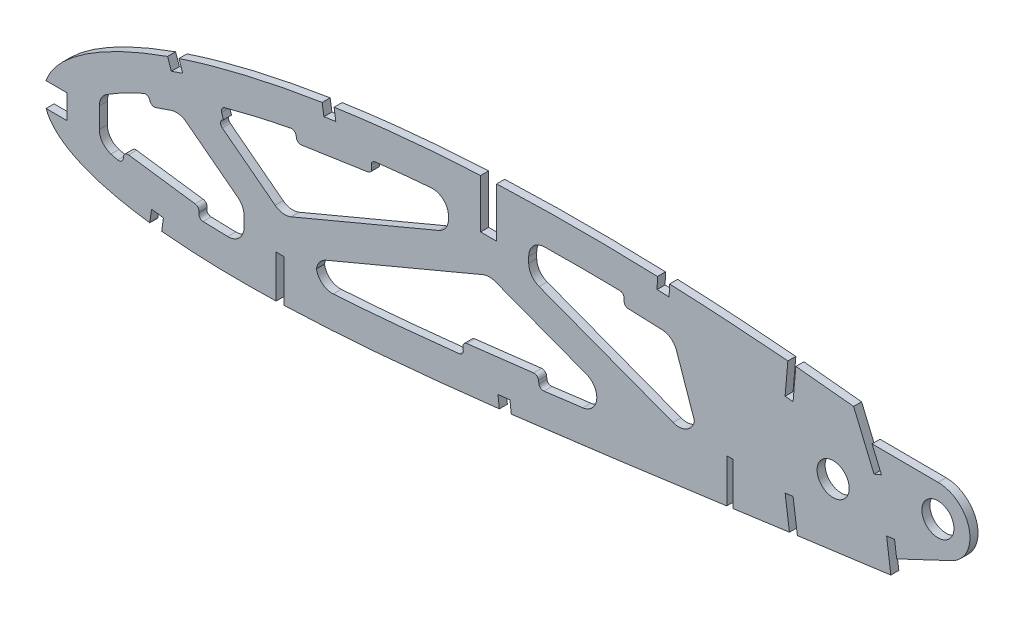
from build123d import *

# Parameters (mm, degrees)
BOSS_EXTRUDE1_DEPTH = 3.175
CUT_EXTRUDE1_DEPTH  = 7.62
SKETCH3_R           = 6.35
CUT_EXTRUDE2_DEPTH  = 7.62
CUT_EXTRUDE3_DEPTH  = 495.005666426
SKETCH5_R           = 6.35
CUT_EXTRUDE5_DEPTH  = 495.005666426
CUT_EXTRUDE9_DEPTH  = 7.62
CUT_EXTRUDE10_DEPTH = 7.62
FILLET1_DEPTH       = 3.175
FILLET2_START       = -1
FILLET2_DEPTH       = 5
FILLET2_2_DEPTH     = 3.175


with BuildPart() as part:
    # Sketch1 → Boss-Extrude1 (new body)
    with BuildSketch(Plane.XY):
        with BuildLine():
            Line((485.587399664, -0.75798934), (490.147728055, -1.684578565))
            Line((490.147728055, -1.684578565), (486.193791136, 0.75798934))
            add(Edge.make_bspline(
                [(486.193791136, 0.75798934), (486.156545565, 0.780998011), (486.007707871, 0.872943377), (485.672349582, 1.078647636), (485.113908292, 1.42125844), (484.332139179, 1.898395939), (483.327649378, 2.508793191), (482.099933618, 3.248176053), (480.649758178, 4.11414228), (478.977474042, 5.102596174), (477.083252712, 6.208909725), (474.9678154, 7.428600903), (472.631346146, 8.754764469), (470.074750091, 10.181981707), (467.298904376, 11.703464898), (464.304334104, 13.312342155), (461.092111509, 15.00042968), (457.663469746, 16.760467008), (454.019033833, 18.582734695), (450.160522056, 20.459648763), (446.08922006, 22.381851369), (441.806517314, 24.339086509), (437.314874314, 26.32337623), (432.615532729, 28.322383702), (427.711170694, 30.327448406), (422.603876177, 32.32715893), (417.296673201, 34.312408193), (411.791609239, 36.270335128), (406.092799427, 38.19238362), (400.203008281, 40.066067188), (394.126447785, 41.881210299), (387.866648542, 43.626044211), (381.42882875, 45.291620487), (374.81707141, 46.865809768), (368.036980395, 48.338075006), (361.093945075, 49.699552264), (353.993788332, 50.936649002), (346.7561854, 52.048400815), (339.497587697, 52.97319004), (332.253923966, 53.880196397), (325.021047815, 54.732245847), (317.699770737, 55.548201081), (310.297136308, 56.323468086), (302.820487344, 57.055622539), (295.277392798, 57.741504683), (287.675691417, 58.379102964), (280.022738792, 58.964804598), (272.326604726, 59.497707184), (264.594897726, 59.973125915), (256.835853078, 60.39070372), (249.05734719, 60.747528421), (241.267474913, 61.041141246), (233.474507978, 61.269769861), (225.686535745, 61.431223873), (217.911990598, 61.524488163), (210.158959277, 61.547014441), (202.435870244, 61.498399603), (194.750810842, 61.376974546), (187.112218127, 61.181076903), (179.528190462, 60.910341158), (172.006928802, 60.56488465), (164.556668167, 60.141814477), (157.185490761, 59.643826715), (149.90160498, 59.068829465), (142.713013757, 58.416669795), (135.627250794, 57.690066178), (128.652204991, 56.887042275), (121.795351463, 56.009883049), (115.064190238, 55.060308222), (108.466273869, 54.03780049), (102.008670179, 52.945313451), (95.69834878, 51.783964779), (89.541985966, 50.557159213), (83.546284377, 49.265216856), (77.717590812, 47.912013041), (72.061962755, 46.499905586), (66.585479912, 45.031479446), (61.293693841, 43.510258272), (56.191955701, 41.93969324), (51.286212878, 40.321510147), (46.580173058, 38.661844322), (42.079617138, 36.961873954), (37.787992638, 35.226836263), (33.71032906, 33.459100147), (29.849672544, 31.664054679), (26.210392495, 29.843743399), (22.795082621, 28.003266258), (19.607171667, 26.145445317), (16.649728276, 24.273731457), (13.923995526, 22.392872215), (11.433731376, 20.504048278), (9.179791317, 18.61203256), (7.163601692, 16.719706143), (5.388044474, 14.828372521), (3.853055719, 12.941362387), (2.560647106, 11.060170164), (1.511042845, 9.186575935), (0.706617001, 7.321940679), (0.14657185, 5.467313049), (-0.159993132, 3.625430402), (-0.236298987, 1.794816138), (-0.078648638, 0.597378122), (0, 0)],
                knots=[0, 0, 0, 0, 0.00025409, 0.001015373, 0.002283359, 0.004056577, 0.006330982, 0.009105274, 0.012374489, 0.016134023, 0.020379661, 0.025105976, 0.030306237, 0.035972206, 0.042099522, 0.048678064, 0.055701664, 0.063160184, 0.071045824, 0.079349827, 0.08806291, 0.097175757, 0.106678111, 0.116561573, 0.126814276, 0.137428301, 0.148393618, 0.15969976, 0.171338125, 0.183297699, 0.195569604, 0.208143556, 0.221011593, 0.234161831, 0.24758745, 0.261276822, 0.27522271, 0.289414144, 0.3037712, 0.317689226, 0.331784111, 0.346039677, 0.36044387, 0.374982721, 0.389640454, 0.404403317, 0.4192566, 0.434186749, 0.449177265, 0.464214782, 0.479284009, 0.49436974, 0.509457833, 0.524532346, 0.53957932, 0.554582984, 0.569529546, 0.584403417, 0.599190992, 0.613876838, 0.628447475, 0.642888675, 0.657186054, 0.671325546, 0.685294014, 0.699078147, 0.712665095, 0.726042645, 0.739197713, 0.752117586, 0.764792042, 0.777208152, 0.789355685, 0.80122396, 0.812803686, 0.824082909, 0.835054602, 0.845709571, 0.856037853, 0.866033834, 0.875688843, 0.884997719, 0.893953426, 0.902552897, 0.910789386, 0.918660734, 0.926166253, 0.933302626, 0.94007122, 0.94647478, 0.952517526, 0.958204819, 0.963546652, 0.9685566, 0.973249913, 0.977651041, 0.981787043, 0.985694226, 0.989415109, 0.993001157, 0.996508416, 1, 1, 1, 1], degree=3))
            add(Edge.make_bspline(
                [(0, 0), (0.124852845, -0.589388692), (0.375132337, -1.770874799), (1.055109044, -3.471725282), (1.954345773, -5.106735278), (3.091715472, -6.671561797), (4.459655687, -8.165777182), (6.055145152, -9.59093561), (7.876619233, -10.946270738), (9.92169391, -12.231165798), (12.187398396, -13.446984767), (14.671186068, -14.592971696), (17.370792198, -15.668768481), (20.283275494, -16.672937055), (23.405075375, -17.607006726), (26.733223776, -18.468701274), (30.263936284, -19.259225009), (33.993816996, -19.976560109), (37.918801514, -20.621435301), (42.034812323, -21.193489669), (46.337624631, -21.693081077), (50.82301706, -22.119161118), (55.4865531, -22.47264634), (60.323584549, -22.753771214), (65.329416188, -22.963427152), (70.499252954, -23.100817142), (75.828031579, -23.168083162), (81.310936338, -23.16623498), (86.942603653, -23.09477832), (92.718222737, -22.957660649), (98.632251256, -22.754013473), (104.679350026, -22.486301136), (110.854064483, -22.157217858), (117.150856575, -21.767879174), (123.564184912, -21.320010643), (130.088480981, -20.817203984), (136.717818035, -20.260713235), (143.446414433, -19.653782206), (150.268313286, -18.999449162), (157.177620607, -18.29978506), (164.168237687, -17.558081099), (171.233938121, -16.77674083), (178.368711149, -15.959932594), (185.566039209, -15.10913432), (192.819836156, -14.229203613), (200.123278023, -13.321821748), (207.470257634, -12.390483576), (214.854167095, -11.43957439), (222.268093801, -10.46898568), (229.705802131, -9.485632582), (237.16011938, -8.488705064), (244.624557097, -7.483330472), (252.092205531, -6.472633763), (259.555791095, -5.456925983), (267.00875308, -4.440416464), (274.444177456, -3.425895825), (281.854781181, -2.413456633), (289.233859631, -1.408131206), (296.573982386, -0.40979664), (303.868380953, 0.579523), (311.110065241, 1.55687475), (318.292203182, 2.521024953), (325.407385919, 3.471363717), (332.448454941, 4.408247897), (339.302915498, 5.303240759), (345.952856872, 6.204000824), (352.420688138, 6.942424504), (358.80798662, 7.572695641), (365.121387221, 8.089431053), (371.353308903, 8.500064921), (377.496611311, 8.807531395), (383.543972889, 9.016123146), (389.487754946, 9.132028332), (395.320533551, 9.158188245), (401.034347101, 9.102945563), (406.621764277, 8.970753247), (412.074986888, 8.767544827), (417.386407281, 8.500176147), (422.548480993, 8.175935919), (427.553458197, 7.799606866), (432.394364707, 7.379974648), (437.06373176, 6.923182232), (441.554389355, 6.434448486), (445.859785012, 5.92401425), (449.973027478, 5.395240442), (453.887929886, 4.85681652), (457.598190253, 4.314198878), (461.097932514, 3.774315295), (464.381658048, 3.242315892), (467.444062607, 2.72526199), (470.280349076, 2.227984348), (472.885595604, 1.755339323), (475.25618804, 1.313290259), (477.38744454, 0.904033197), (479.2765147, 0.534312721), (480.919885909, 0.205760173), (482.315149055, -0.076995438), (483.459867496, -0.312838295), (484.352302675, -0.497896754), (484.990691913, -0.632466588), (485.3743447, -0.712542465), (485.54480657, -0.748903783), (485.587399664, -0.75798934)],
                knots=[0, 0, 0, 0, 0.003638255, 0.007293231, 0.011028136, 0.014901081, 0.018963272, 0.023258475, 0.027820626, 0.032679082, 0.03785316, 0.043361875, 0.049214679, 0.055422346, 0.061988786, 0.068918036, 0.076211157, 0.083868392, 0.091887411, 0.100265912, 0.108999867, 0.118084529, 0.127514843, 0.13728527, 0.147387917, 0.157816481, 0.168563473, 0.179619128, 0.190977373, 0.202626974, 0.214560478, 0.226767249, 0.239236417, 0.251959004, 0.264923894, 0.278119703, 0.291536035, 0.30516028, 0.318980685, 0.332985499, 0.34716279, 0.361498603, 0.375980747, 0.390597192, 0.405332593, 0.420174823, 0.435109533, 0.450124276, 0.465203068, 0.480333154, 0.495500583, 0.510689775, 0.525887334, 0.541078314, 0.556247233, 0.571381785, 0.58646604, 0.601484516, 0.616424329, 0.631269423, 0.646006524, 0.660620684, 0.675098188, 0.689422858, 0.703581824, 0.716907564, 0.730009274, 0.742952128, 0.755725558, 0.768319952, 0.780724337, 0.792926528, 0.804916041, 0.816679084, 0.828203524, 0.8394749, 0.850481359, 0.861207697, 0.871639326, 0.881763414, 0.891563605, 0.901027364, 0.910138977, 0.918883976, 0.927249278, 0.935221104, 0.942784738, 0.949928188, 0.956638464, 0.962904204, 0.968712288, 0.974054485, 0.978918432, 0.983297218, 0.987180246, 0.990560674, 0.993433357, 0.995790626, 0.997629587, 0.998945816, 0.999736592, 1, 1, 1, 1], degree=3))
        make_face()
    extrude(amount=BOSS_EXTRUDE1_DEPTH)

    # Sketch2 → Cut-Extrude1 (cut)
    with BuildSketch(Plane(origin=(0, 0, 0), x_dir=(-1, 0, 0), z_dir=(0, 0, -1))):
        Polygon((-272.758362457, 13.219227593), (-272.758362457, -3.727335201), (-272.758362457, -6.174624217), (-270.218362457, -4.538950955), (-270.218362457, -3.727335201), (-270.218362457, 13.219227593), align=None)
        Polygon((-179.095862457, 60.936207213), (-179.095862457, 41.210430096), (-172.745862457, 41.210430096), (-172.745862457, 60.936207213), (-172.745862457, 62.491605953), (-179.095862457, 65.673418397), align=None)
        Polygon((-94.958362457, -6.174624217), (-94.958362457, -22.484645348), (-94.958362457, -23.41160534), (-91.783362457, -23.055975463), (-91.783362457, -22.484645348), (-91.783362457, -6.174624217), align=None)
    extrude(amount=-CUT_EXTRUDE1_DEPTH, mode=Mode.SUBTRACT)

    # Sketch3 → Cut-Extrude2 (cut)
    with BuildSketch(Plane(origin=(0, 0, 0), x_dir=(-1, 0, 0), z_dir=(0, 0, -1))):
        with Locations((-312.347728055, 26.255421435)):
            Circle(SKETCH3_R)
    extrude(amount=-CUT_EXTRUDE2_DEPTH, mode=Mode.SUBTRACT)

    # Sketch4 → Cut-Extrude3 (cut, through all)
    with BuildSketch(Plane.XY.offset(3.175)):
        with BuildLine():
            Line((9.062901794, 7.052169294), (0.650194113, 7.052169294))
            add(Edge.make_bspline(
                [(0.650194113, 7.052169294), (0.465708548, 6.521896536), (0.133397668, 5.38816083), (-0.159993132, 3.625430402), (-0.236298987, 1.794816138), (-0.078648638, 0.597378122), (0, 0)],
                knots=[0.98615895, 0.98615895, 0.98615895, 0.98615895, 0.989415109, 0.993001157, 0.996508416, 1, 1, 1, 1], degree=3))
            add(Edge.make_bspline(
                [(0, 0), (0.124852845, -0.589388692), (0.302256405, -1.426851801), (0.579848755, -2.235845493), (0.669602921, -2.472830706)],
                knots=[0, 0, 0, 0, 0.003638255, 0.005169601, 0.005169601, 0.005169601, 0.005169601], degree=3))
            Line((0.669602921, -2.472830706), (9.062901794, -2.472830706))
            Line((9.062901794, -2.472830706), (9.062901794, 7.052169294))
        make_face()
        with BuildLine():
            add(Edge.make_bspline(
                [(0.650194113, 7.052169294), (0.465708548, 6.521896536), (0.133397668, 5.38816083), (-0.159993132, 3.625430402), (-0.236298987, 1.794816138), (-0.078648638, 0.597378122), (0, 0)],
                knots=[0.98615895, 0.98615895, 0.98615895, 0.98615895, 0.989415109, 0.993001157, 0.996508416, 1, 1, 1, 1], degree=3))
            Line((0.650194113, 7.052169294), (-0.462098206, 7.052169294))
            Line((-0.462098206, 7.052169294), (-0.462098206, -2.472830706))
            Line((-0.462098206, -2.472830706), (0.669602921, -2.472830706))
            add(Edge.make_bspline(
                [(0, 0), (0.124852845, -0.589388692), (0.302256405, -1.426851801), (0.579848755, -2.235845493), (0.669602921, -2.472830706)],
                knots=[0, 0, 0, 0, 0.003638255, 0.005169601, 0.005169601, 0.005169601, 0.005169601], degree=3))
        make_face()
        with BuildLine():
            Line((54.794831429, 36.648863619), (53.302696873, 40.981678359))
            add(Edge.make_bspline(
                [(53.302696873, 40.981678359), (52.61286541, 40.752815486), (51.108174168, 40.246442968), (49.608389515, 39.725673213), (48.796794552, 39.438833377)],
                knots=[0.861815619, 0.861815619, 0.861815619, 0.861815619, 0.866033834, 0.871029674, 0.871029674, 0.871029674, 0.871029674], degree=3))
            Line((48.796794552, 39.438833377), (50.292020972, 35.098046912))
            Line((50.292020972, 35.098046912), (54.794831429, 36.648863619))
        make_face()
        with BuildLine():
            Line((41.787252136, -20.850695067), (41.7474831, -21.140589239))
            add(Edge.make_bspline(
                [(41.7474831, -21.140589239), (41.824488615, -21.150525072), (43.333830589, -21.344316226), (44.907255765, -21.527003651), (46.405229922, -21.684741935), (46.467066592, -21.691225989)],
                knots=[0.099796316, 0.099796316, 0.099796316, 0.099796316, 0.100265912, 0.108999867, 0.109375913, 0.109375913, 0.109375913, 0.109375913], degree=3))
            Line((46.467066592, -21.691225989), (46.491055727, -21.515107109))
            Line((46.491055727, -21.515107109), (47.147668691, -16.75670807))
            Line((47.147668691, -16.75670807), (42.43642749, -16.110398001))
            Line((42.43642749, -16.110398001), (41.787252136, -20.850695067))
        make_face()
        with BuildLine():
            add(Edge.make_bspline(
                [(41.7474831, -21.140589239), (41.824488615, -21.150525072), (43.333830589, -21.344316226), (44.907255765, -21.527003651), (46.405229922, -21.684741935), (46.467066592, -21.691225989)],
                knots=[0.099796316, 0.099796316, 0.099796316, 0.099796316, 0.100265912, 0.108999867, 0.109375913, 0.109375913, 0.109375913, 0.109375913], degree=3))
            Line((41.7474831, -21.140589239), (41.245228792, -24.801744004))
            Line((41.245228792, -24.801744004), (45.955369961, -25.447903166))
            Line((45.955369961, -25.447903166), (46.467066592, -21.691225989))
        make_face()
        with BuildLine():
            Line((115.411216261, 50.423603453), (114.727657639, 54.994935898))
            add(Edge.make_bspline(
                [(114.727657639, 54.994935898), (113.150509681, 54.76041064), (111.574494653, 54.518257541), (109.999719487, 54.268289878)],
                knots=[0.739781871, 0.739781871, 0.739781871, 0.739781871, 0.749036025, 0.749036025, 0.749036025, 0.749036025], degree=3))
            Line((109.999719487, 54.268289878), (110.701108213, 49.719265409))
            Line((110.701108213, 49.719265409), (115.411216261, 50.423603453))
        make_face()
        with BuildLine():
            add(Edge.make_bspline(
                [(180.171004029, -15.744952069), (181.749324096, -15.559869925), (183.327429501, -15.372956575), (184.90534275, -15.184435959)],
                knots=[0.379684808, 0.379684808, 0.379684808, 0.379684808, 0.389296233, 0.389296233, 0.389296233, 0.389296233], degree=3))
            Line((184.90534275, -15.184435959), (184.356728474, -10.534942837))
            Line((184.356728474, -10.534942837), (179.627040288, -11.093017525))
            Line((179.627040288, -11.093017525), (180.171004029, -15.744952069))
        make_face()
        with BuildLine():
            Line((247.390399473, 56.230958409), (247.578395082, 60.797552648))
            add(Edge.make_bspline(
                [(247.578395082, 60.797552648), (245.984239368, 60.86167677), (244.389922115, 60.921786857), (242.795461786, 60.97783048)],
                knots=[0.482152267, 0.482152267, 0.482152267, 0.482152267, 0.491412006, 0.491412006, 0.491412006, 0.491412006], degree=3))
            Line((242.795461786, 60.97783048), (242.631589462, 56.412390301))
            Line((242.631589462, 56.412390301), (247.390399473, 56.230958409))
        make_face()
        Polygon((294.40507718, 57.808484267), (297.56784199, 57.529978748), (296.472728055, 44.881943939), (293.309562632, 45.155822576), align=None)
        with BuildLine():
            add(Edge.make_bspline(
                [(295.036807926, -0.619102057), (296.085502034, -0.476588541), (297.134206476, -0.334150977), (298.182924105, -0.191810533)],
                knots=[0, 0, 0, 0, 1, 1, 1, 1], degree=3))
            Line((298.182924105, -0.191810533), (296.472728055, 12.392767846))
            Line((296.472728055, 12.392767846), (293.326645717, 11.965227294))
            Line((293.326645717, 11.965227294), (295.036807926, -0.619102057))
        make_face()
        with BuildLine():
            Line((298.509707059, -2.59646215), (298.182924105, -0.191810533))
            add(Edge.make_bspline(
                [(295.036807926, -0.619102057), (296.085502034, -0.476588541), (297.134206476, -0.334150977), (298.182924105, -0.191810533)],
                knots=[0, 0, 0, 0, 1, 1, 1, 1], degree=3))
            Line((295.036807926, -0.619102057), (295.328583802, -3.088940197))
            Line((295.328583802, -3.088940197), (298.509707059, -2.59646215))
        make_face()
    extrude(amount=-CUT_EXTRUDE3_DEPTH, mode=Mode.SUBTRACT)


with BuildPart() as cut_extrude3_kept_piece:
    # of the separate pieces the step leaves, the one the design keeps (cut_extrude3_pieces_kept)
    add(part.part.solids().sort_by_distance((485.587399664, -0.75798934, 0))[0])

    # Sketch5 → Cut-Extrude5 (cut, through all)
    with BuildSketch(Plane.XY.offset(3.175)):
        with Locations((353.832919875, 33.232574886)):
            Circle(SKETCH5_R)
    extrude(amount=-CUT_EXTRUDE5_DEPTH, mode=Mode.SUBTRACT)

    # Sketch6 → Cut-Extrude9 (cut)
    with BuildSketch(Plane(origin=(0, 0, 0), x_dir=(-1, 0, 0), z_dir=(0, 0, -1))):
        with BuildLine():
            Line((-327.753809852, 46.057810612), (-331.453456008, 37.280667379))
            Line((-331.453456008, 37.280667379), (-328.527741597, 36.047451994))
            Line((-328.527741597, 36.047451994), (-321.128449286, 53.601738459))
            Line((-321.128449286, 53.601738459), (-317.790242381, 61.521393181))
            Line((-317.790242381, 61.521393181), (-514.651526297, 76.475822003))
            Line((-514.651526297, 76.475822003), (-498.413214754, -38.047006775))
            Line((-498.413214754, -38.047006775), (-335.182817631, 4.763039252))
            Line((-335.182817631, 4.763039252), (-333.516134292, 17.353200754))
            Line((-333.516134292, 17.353200754), (-336.663674667, 17.769871589))
            Line((-336.663674667, 17.769871589), (-337.497016337, 11.474790838))
            Line((-337.497016337, 11.474790838), (-359.255381148, 21.748372095))
            ThreePointArc((-359.255381148, 21.748372095), (-366.23187163, 35.981391973), (-353.8938353, 45.932428795))
            Line((-353.8938353, 45.932428795), (-327.753809852, 46.057810612))
        make_face()
    extrude(amount=-CUT_EXTRUDE9_DEPTH, mode=Mode.SUBTRACT)

    # Sketch7 → Cut-Extrude10 (cut)
    with BuildSketch(Plane(origin=(0, 0, 0), x_dir=(-1, 0, 0), z_dir=(0, 0, -1))):
        with BuildLine():
            Line((-191.79586246, 35.636390316), (-191.79586246, 48.593590966))
            add(Edge.make_bspline(
                [(-191.79586246, 48.593590966), (-194.947742991, 48.672167599), (-201.251688751, 48.789985812), (-210.714122089, 48.853923109), (-220.178220019, 48.809690173), (-226.489591064, 48.710234484), (-229.644558964, 48.643649352)],
                knots=[0.121974497, 0.121974497, 0.121974497, 0.121974497, 0.309757138, 0.497539778, 0.685322418, 0.873105059, 0.873105059, 0.873105059, 0.873105059], degree=3))
            Line((-229.644558964, 48.643649352), (-229.48521526, 44.20437536))
            Line((-229.48521526, 44.20437536), (-248.891837233, 43.464488679))
            Line((-248.891837233, 43.464488679), (-257.518362457, 18.502913174))
            Line((-257.518362457, 18.502913174), (-257.518362457, 10.736351923))
            Line((-257.518362457, 10.736351923), (-191.79586246, 35.636390316))
        make_face()
        with BuildLine():
            Line((-107.658362457, -9.607113499), (-107.658362457, -0.709195855))
            Line((-107.658362457, -0.709195855), (-176.042623936, 28.023836531))
            Line((-176.042623936, 28.023836531), (-238.217406918, 4.467908448))
            add(Edge.make_bspline(
                [(-196.023618722, -1.032687245), (-199.540285566, -0.594653843), (-206.570896125, 0.294533789), (-217.119095381, 1.66162252), (-227.668063289, 3.053878273), (-234.701374525, 3.994956751), (-238.217406918, 4.467908448)],
                knots=[0.338101016, 0.338101016, 0.338101016, 0.338101016, 0.481994526, 0.625888035, 0.769781544, 0.913675053, 0.913675053, 0.913675053, 0.913675053], degree=3))
            Line((-196.023618722, -1.032687245), (-195.481027558, 3.56576015))
            Line((-195.481027558, 3.56576015), (-165.539531563, 0.032844157))
            Line((-165.539531563, 0.032844157), (-166.077556286, -4.568300384))
            add(Edge.make_bspline(
                [(-107.658362457, -9.607113499), (-112.527480958, -9.343730572), (-122.253868861, -8.715147959), (-136.863916935, -7.5251334), (-151.469960854, -6.138042935), (-161.211151019, -5.105470024), (-166.077556286, -4.568300384)],
                knots=[0.088650257, 0.088650257, 0.088650257, 0.088650257, 0.293249758, 0.497849259, 0.70244876, 0.907048261, 0.907048261, 0.907048261, 0.907048261], degree=3))
        make_face()
        with BuildLine():
            Line((-160.045862457, 35.077981459), (-94.307868179, 7.45683183))
            Line((-94.307868179, 7.45683183), (-67.862121325, 27.717253053))
            Line((-67.862121325, 27.717253053), (-70.937887187, 28.77658014))
            Line((-70.937887187, 28.77658014), (-69.597188192, 32.669660912))
            add(Edge.make_bspline(
                [(-69.597188192, 32.669660912), (-72.048300438, 33.353969811), (-76.964507952, 34.65883166), (-84.404673933, 36.449093236), (-91.887886191, 38.082795077), (-96.906758154, 39.075219685), (-99.419258475, 39.548192007)],
                knots=[0.151488346, 0.151488346, 0.151488346, 0.151488346, 0.326718884, 0.501949421, 0.677179959, 0.852410496, 0.852410496, 0.852410496, 0.852410496], degree=3))
            Line((-99.419258475, 39.548192007), (-100.075929965, 35.289191879))
            Line((-100.075929965, 35.289191879), (-129.849728439, 39.741492922))
            Line((-129.849728439, 39.741492922), (-129.191480565, 44.143558413))
            add(Edge.make_bspline(
                [(-129.191480565, 44.143558413), (-131.75327506, 44.459716525), (-136.880521808, 45.054977888), (-144.588732985, 45.842272199), (-152.309866282, 46.528260609), (-157.466847891, 46.921282613), (-160.045862457, 47.102373106)],
                knots=[0.145865613, 0.145865613, 0.145865613, 0.145865613, 0.321281856, 0.496698098, 0.67211434, 0.847530583, 0.847530583, 0.847530583, 0.847530583], degree=3))
            Line((-160.045862457, 47.102373106), (-160.045862457, 35.077981459))
        make_face()
        with BuildLine():
            Line((-79.083362457, 3.121902297), (-79.083362457, -10.463821932))
            add(Edge.make_bspline(
                [(-79.083362457, -10.463821932), (-77.563003161, -10.466266649), (-74.520718627, -10.454806626), (-69.966862179, -10.38447701), (-65.421068879, -10.25697491), (-62.402825335, -10.129408024), (-60.892970489, -10.053632048)],
                knots=[0.1994192, 0.1994192, 0.1994192, 0.1994192, 0.345131723, 0.490844245, 0.636556768, 0.78226929, 0.78226929, 0.78226929, 0.78226929], degree=3))
            Line((-60.892970489, -10.053632048), (-61.465856007, -5.901996226))
            Line((-61.465856007, -5.901996226), (-31.5774301, -1.801762384))
            Line((-31.5774301, -1.801762384), (-30.948701379, -6.392757546))
            add(Edge.make_bspline(
                [(-30.948701379, -6.392757546), (-30.157078307, -6.212830315), (-28.572887294, -5.832169738), (-26.244901191, -5.203855136), (-23.964951823, -4.508855169), (-22.495451176, -3.999764625), (-21.762901794, -3.727289386)],
                knots=[0.316984494, 0.316984494, 0.316984494, 0.316984494, 0.436482572, 0.555980651, 0.675478729, 0.794976808, 0.794976808, 0.794976808, 0.794976808], degree=3))
            Line((-21.762901794, -3.727289386), (-21.762901794, 12.3569693))
            add(Edge.make_bspline(
                [(-21.762901794, 12.3569693), (-22.485713516, 12.871304647), (-23.946210775, 13.863781661), (-26.995933142, 15.782547153), (-30.973640972, 18.027704874), (-35.957277852, 20.528528125), (-39.374554059, 22.071181385), (-41.091891456, 22.811562983)],
                knots=[0.179419269, 0.179419269, 0.179419269, 0.179419269, 0.258794815, 0.338170361, 0.496921453, 0.655672544, 0.814423636, 0.814423636, 0.814423636, 0.814423636], degree=3))
            Line((-41.091891456, 22.811562983), (-42.420377223, 18.954840736))
            Line((-42.420377223, 18.954840736), (-53.455747952, 22.755541978))
            Line((-53.455747952, 22.755541978), (-79.083362457, 3.121902297))
        make_face()
    extrude(amount=-CUT_EXTRUDE10_DEPTH, mode=Mode.SUBTRACT)

    # Fillet1: read off the stored shape, not the designer's step
    # Fillet1 outline → Fillet1 (add)
    with BuildSketch(Plane.XY):
        with BuildLine():
            add(Edge.make_bspline(
                [(26.370126448, -5.226300247), (26.331032698, -5.215142403), (25.523563297, -4.983968756), (23.964951823, -4.508855169), (22.495451176, -3.999764625), (21.762901794, -3.727289386)],
                knots=[0.54990416, 0.54990416, 0.54990416, 0.54990416, 0.555980651, 0.675478729, 0.794976808, 0.794976808, 0.794976808, 0.794976808], degree=3))
            ThreePointArc((26.370126448, -5.226300247), (23.043921451, -2.94478541), (21.762901794, 0.879863368))
            Line((21.762901794, 0.879863368), (21.762901794, -3.727289386))
        make_face()
        with BuildLine():
            Line((21.762901794, 12.3569693), (21.762901794, 8.976965526))
            ThreePointArc((21.762901794, 8.976965526), (22.544922642, 12.029850745), (24.698368932, 14.330792692))
            add(Edge.make_bspline(
                [(21.762901794, 12.3569693), (22.485713516, 12.871304647), (23.454406807, 13.529577587), (24.451414905, 14.173291784), (24.698368932, 14.330792692)],
                knots=[0.179419269, 0.179419269, 0.179419269, 0.179419269, 0.258794815, 0.28471294, 0.28471294, 0.28471294, 0.28471294], degree=3))
        make_face()
        with BuildLine():
            Line((79.083362457, -10.463821932), (79.083362457, -4.073978435))
            ThreePointArc((79.083362457, -4.073978435), (77.190824363, -8.596536711), (72.641304706, -10.423311106))
            add(Edge.make_bspline(
                [(79.083362457, -10.463821932), (77.563003161, -10.466266649), (75.413933546, -10.45817129), (73.268047675, -10.432398132), (72.641304706, -10.423311106)],
                knots=[0.1994192, 0.1994192, 0.1994192, 0.1994192, 0.345131723, 0.405281835, 0.405281835, 0.405281835, 0.405281835], degree=3))
        make_face()
        with BuildLine():
            Line((79.083362457, 3.121902297), (76.595143679, 5.028158181))
            ThreePointArc((76.595143679, 5.028158181), (78.427430017, 2.798120343), (79.083362457, -0.012590354))
            Line((79.083362457, -0.012590354), (79.083362457, 3.121902297))
        make_face()
        with BuildLine():
            ThreePointArc((50.232412236, 21.645390234), (53.31830221, 21.909355752), (56.161997924, 20.682249638))
            Line((56.161997924, 20.682249638), (53.455747952, 22.755541978))
            Line((53.455747952, 22.755541978), (50.232412236, 21.645390234))
        make_face()
        with BuildLine():
            ThreePointArc((153.182534733, 46.583384691), (158.000677723, 44.922257289), (160.045862457, 40.254167153))
            Line((160.045862457, 40.254167153), (160.045862457, 47.102373106))
            add(Edge.make_bspline(
                [(153.182534733, 46.583384691), (155.469028821, 46.768829542), (157.757239412, 46.941673015), (160.045862457, 47.102373106)],
                knots=[0.691865834, 0.691865834, 0.691865834, 0.691865834, 0.847530583, 0.847530583, 0.847530583, 0.847530583], degree=3))
        make_face()
        with BuildLine():
            ThreePointArc((160.045862457, 39.297654474), (158.984627042, 35.783188773), (156.155635949, 33.443424006))
            Line((156.155635949, 33.443424006), (160.045862457, 35.077981459))
            Line((160.045862457, 35.077981459), (160.045862457, 39.297654474))
        make_face()
        with BuildLine():
            ThreePointArc((97.704647392, 8.884057408), (94.434414381, 8.440220286), (91.383092679, 9.697539341))
            Line((91.383092679, 9.697539341), (94.307868179, 7.45683183))
            Line((94.307868179, 7.45683183), (97.704647392, 8.884057408))
        make_face()
        with BuildLine():
            Line((238.217406918, 4.467908448), (214.658298466, 13.393659979))
            ThreePointArc((214.658298466, 13.393659979), (218.715500901, 6.717402319), (213.22631845, 1.158429037))
            add(Edge.make_bspline(
                [(238.217406918, 4.467908448), (234.701374525, 3.994956751), (227.668063289, 3.053878273), (219.337714047, 1.954436436), (214.523927555, 1.326941616), (213.22631845, 1.158429037)],
                knots=[0.338101016, 0.338101016, 0.338101016, 0.338101016, 0.481994526, 0.625888035, 0.678992143, 0.678992143, 0.678992143, 0.678992143], degree=3))
        make_face()
        with BuildLine():
            ThreePointArc((107.742134816, -3.900816755), (109.022505127, -0.996474347), (111.548588965, 0.925361597))
            Line((111.548588965, 0.925361597), (107.658362457, -0.709195855))
            Line((107.658362457, -0.709195855), (107.658362457, -9.607113499))
            add(Edge.make_bspline(
                [(114.410021767, -9.210048742), (112.1601201, -9.352648306), (109.909874671, -9.485323512), (107.658362457, -9.607113499)],
                knots=[0.812440114, 0.812440114, 0.812440114, 0.812440114, 0.907048261, 0.907048261, 0.907048261, 0.907048261], degree=3))
            ThreePointArc((114.410021767, -9.210048742), (110.052951417, -7.840382126), (107.742134816, -3.900816755))
        make_face()
        with BuildLine():
            ThreePointArc((173.704611923, 27.041473434), (176.051308225, 27.536236079), (178.414134341, 27.125351231))
            Line((178.414134341, 27.125351231), (176.042623936, 28.023836531))
            Line((176.042623936, 28.023836531), (173.704611923, 27.041473434))
        make_face()
        with BuildLine():
            ThreePointArc((244.550970789, 43.629986274), (248.091456487, 42.385174627), (250.31075261, 39.358737823))
            Line((250.31075261, 39.358737823), (248.891837233, 43.464488679))
            Line((248.891837233, 43.464488679), (244.550970789, 43.629986274))
        make_face()
        with BuildLine():
            ThreePointArc((257.394515021, 18.684606869), (254.242806526, 14.376510801), (248.918613531, 13.994506717))
            Line((248.918613531, 13.994506717), (257.518362457, 10.736351923))
            Line((257.518362457, 10.736351923), (257.518362457, 18.502913174))
            Line((257.518362457, 18.502913174), (257.170065285, 19.510740303))
            ThreePointArc((257.170065285, 19.510740303), (257.29622799, 19.101460315), (257.394515021, 18.684606869))
        make_face()
        with BuildLine():
            Line((191.79586246, 48.593590966), (191.79586246, 42.374654055))
            ThreePointArc((191.79586246, 42.374654055), (193.618162404, 46.826893065), (198.039148193, 48.723757304))
            add(Edge.make_bspline(
                [(191.79586246, 48.593590966), (193.876822148, 48.645469457), (195.95782209, 48.688774854), (198.039148193, 48.723757304)],
                knots=[0.121974497, 0.121974497, 0.121974497, 0.121974497, 0.245953849, 0.245953849, 0.245953849, 0.245953849], degree=3))
        make_face()
        with BuildLine():
            ThreePointArc((195.896113534, 34.082943488), (192.920520094, 36.41296401), (191.79586246, 40.021051753))
            Line((191.79586246, 40.021051753), (191.79586246, 35.636390316))
            Line((191.79586246, 35.636390316), (195.896113534, 34.082943488))
        make_face()
    extrude(amount=FILLET1_DEPTH)

    # Fillet2: read off the stored shape, not the designer's step
    # Fillet2 outline → Fillet2 (cut)
    with BuildSketch(Plane.XY.offset(FILLET2_START)):
        with BuildLine():
            ThreePointArc((44.101392599, 19.533800644), (42.74313732, 19.616758748), (41.841343736, 20.635830768))
            Line((41.841343736, 20.635830768), (42.420377223, 18.954840736))
            Line((42.420377223, 18.954840736), (44.101392599, 19.533800644))
        make_face()
        with BuildLine():
            Line((61.465856007, -5.901996226), (59.702960833, -5.660154034))
            ThreePointArc((59.702960833, -5.660154034), (60.878177539, -6.347519133), (61.222620016, -7.664699631))
            Line((61.222620016, -7.664699631), (61.465856007, -5.901996226))
        make_face()
        with BuildLine():
            Line((31.5774301, -1.801762384), (31.336131852, -3.563729114))
            ThreePointArc((31.336131852, -3.563729114), (32.022828579, -2.388653081), (33.339340784, -2.04346952))
            Line((33.339340784, -2.04346952), (31.5774301, -1.801762384))
        make_face()
        with BuildLine():
            ThreePointArc((129.586786216, 41.499932152), (129.257680682, 40.179510323), (128.091290742, 39.478540448))
            Line((128.091290742, 39.478540448), (129.849728439, 39.741492922))
            Line((129.849728439, 39.741492922), (129.586786216, 41.499932152))
        make_face()
        with BuildLine():
            ThreePointArc((101.826408928, 35.550954224), (100.509229866, 35.877657247), (99.806219473, 37.038463834))
            Line((99.806219473, 37.038463834), (100.075929965, 35.289191879))
            Line((100.075929965, 35.289191879), (101.826408928, 35.550954224))
        make_face()
        with BuildLine():
            Line((195.481027558, 3.56576015), (193.715277764, 3.357412321))
            ThreePointArc((193.715277764, 3.357412321), (195.024875359, 2.987560424), (195.689376182, 1.800010449))
            Line((195.689376182, 1.800010449), (195.481027558, 3.56576015))
        make_face()
        with BuildLine():
            Line((165.539531563, 0.032844157), (165.745815079, -1.73127603))
            ThreePointArc((165.745815079, -1.73127603), (166.116460884, -0.422796081), (167.303434862, 0.240974111))
            Line((167.303434862, 0.240974111), (165.539531563, 0.032844157))
        make_face()
        with BuildLine():
            ThreePointArc((231.257969768, 44.136788252), (230.022833806, 44.703619876), (229.548851919, 45.977276072))
            Line((229.548851919, 45.977276072), (229.48521526, 44.20437536))
            Line((229.48521526, 44.20437536), (231.257969768, 44.136788252))
        make_face()
    extrude(amount=FILLET2_DEPTH, mode=Mode.SUBTRACT)

    # Fillet2 2 outline → Fillet2 2 (add)
    with BuildSketch(Plane.XY):
        with BuildLine():
            add(Edge.make_bspline(
                [(39.315293803, 22.032928635), (39.906041202, 22.296174014), (40.498446928, 22.555716107), (41.091891456, 22.811562983)],
                knots=[0.759565478, 0.759565478, 0.759565478, 0.759565478, 0.814423636, 0.814423636, 0.814423636, 0.814423636], degree=3))
            ThreePointArc((39.315293803, 22.032928635), (40.7476112, 22.039566156), (41.72005753, 20.987936316))
            Line((41.72005753, 20.987936316), (41.091891456, 22.811562983))
        make_face()
        with BuildLine():
            Line((30.948701379, -6.392757546), (31.214736012, -4.450165023))
            ThreePointArc((31.214736012, -4.450165023), (30.449923658, -5.681261841), (29.022816751, -5.93405264))
            add(Edge.make_bspline(
                [(30.948701379, -6.392757546), (30.305528084, -6.24657132), (29.662042929, -6.093517886), (29.022816751, -5.93405264)],
                knots=[0.316984494, 0.316984494, 0.316984494, 0.316984494, 0.414073595, 0.414073595, 0.414073595, 0.414073595], degree=3))
        make_face()
        with BuildLine():
            ThreePointArc((62.843041929, -10.144945399), (61.554840188, -9.507359504), (61.15902266, -8.125582394))
            Line((61.15902266, -8.125582394), (60.892970489, -10.053632048))
            add(Edge.make_bspline(
                [(62.843041929, -10.144945399), (62.192951587, -10.116658756), (61.543028982, -10.086256917), (60.892970489, -10.053632048)],
                knots=[0.719533681, 0.719533681, 0.719533681, 0.719533681, 0.78226929, 0.78226929, 0.78226929, 0.78226929], degree=3))
        make_face()
        with BuildLine():
            Line((69.597188192, 32.669660912), (70.213531067, 30.879943307))
            ThreePointArc((70.213531067, 30.879943307), (70.323007077, 32.290306545), (71.427332495, 33.174373756))
            add(Edge.make_bspline(
                [(69.597188192, 32.669660912), (70.206783421, 32.839849544), (70.816811093, 33.008066446), (71.427332495, 33.174373756)],
                knots=[0.151488346, 0.151488346, 0.151488346, 0.151488346, 0.195068439, 0.195068439, 0.195068439, 0.195068439], degree=3))
        make_face()
        with BuildLine():
            Line((129.191480565, 44.143558413), (129.461712549, 42.336368539))
            ThreePointArc((129.461712549, 42.336368539), (129.806321447, 43.677430472), (131.008372626, 44.364653409))
            add(Edge.make_bspline(
                [(129.191480565, 44.143558413), (129.797004402, 44.218287777), (130.402630417, 44.291982025), (131.008372626, 44.364653409)],
                knots=[0.145865613, 0.145865613, 0.145865613, 0.145865613, 0.187328235, 0.187328235, 0.187328235, 0.187328235], degree=3))
        make_face()
        with BuildLine():
            add(Edge.make_bspline(
                [(97.606009067, 39.202689678), (98.210206728, 39.319211631), (98.814643875, 39.43437472), (99.419258475, 39.548192007)],
                knots=[0.810242565, 0.810242565, 0.810242565, 0.810242565, 0.852410496, 0.852410496, 0.852410496, 0.852410496], degree=3))
            ThreePointArc((97.606009067, 39.202689678), (98.966571373, 38.910465324), (99.69993493, 37.72779768))
            Line((99.69993493, 37.72779768), (99.419258475, 39.548192007))
        make_face()
        with BuildLine():
            ThreePointArc((70.490155469, 25.703882849), (69.812034332, 27.37166266), (70.937887187, 28.77658014))
            Line((70.937887187, 28.77658014), (67.862121325, 27.717253053))
            Line((67.862121325, 27.717253053), (70.490155469, 25.703882849))
        make_face()
        with BuildLine():
            Line((166.077556286, -4.568300384), (165.869606173, -2.789927598))
            ThreePointArc((165.869606173, -2.789927598), (165.494216534, -4.104387729), (164.296817558, -4.763901574))
            add(Edge.make_bspline(
                [(166.077556286, -4.568300384), (165.484035921, -4.633815092), (164.890453233, -4.699019164), (164.296817558, -4.763901574)],
                knots=[0.088650257, 0.088650257, 0.088650257, 0.088650257, 0.113603783, 0.113603783, 0.113603783, 0.113603783], degree=3))
        make_face()
        with BuildLine():
            ThreePointArc((197.800473235, -0.810796649), (196.483311637, -0.446365463), (195.813851798, 0.745082517))
            Line((195.813851798, 0.745082517), (196.023618722, -1.032687245))
            add(Edge.make_bspline(
                [(197.800473235, -0.810796649), (197.208221475, -0.884943082), (196.615939412, -0.958908222), (196.023618722, -1.032687245)],
                knots=[0.889438722, 0.889438722, 0.889438722, 0.889438722, 0.913675053, 0.913675053, 0.913675053, 0.913675053], degree=3))
        make_face()
        with BuildLine():
            add(Edge.make_bspline(
                [(227.836782823, 48.679951574), (228.439395423, 48.668468689), (229.041990282, 48.656366475), (229.644558964, 48.643649352)],
                knots=[0.837240371, 0.837240371, 0.837240371, 0.837240371, 0.873105059, 0.873105059, 0.873105059, 0.873105059], degree=3))
            ThreePointArc((227.836782823, 48.679951574), (229.094197175, 48.124509343), (229.579764613, 46.838495661))
            Line((229.579764613, 46.838495661), (229.644558964, 48.643649352))
        make_face()
    extrude(amount=FILLET2_2_DEPTH)


solid = cut_extrude3_kept_piece.part
